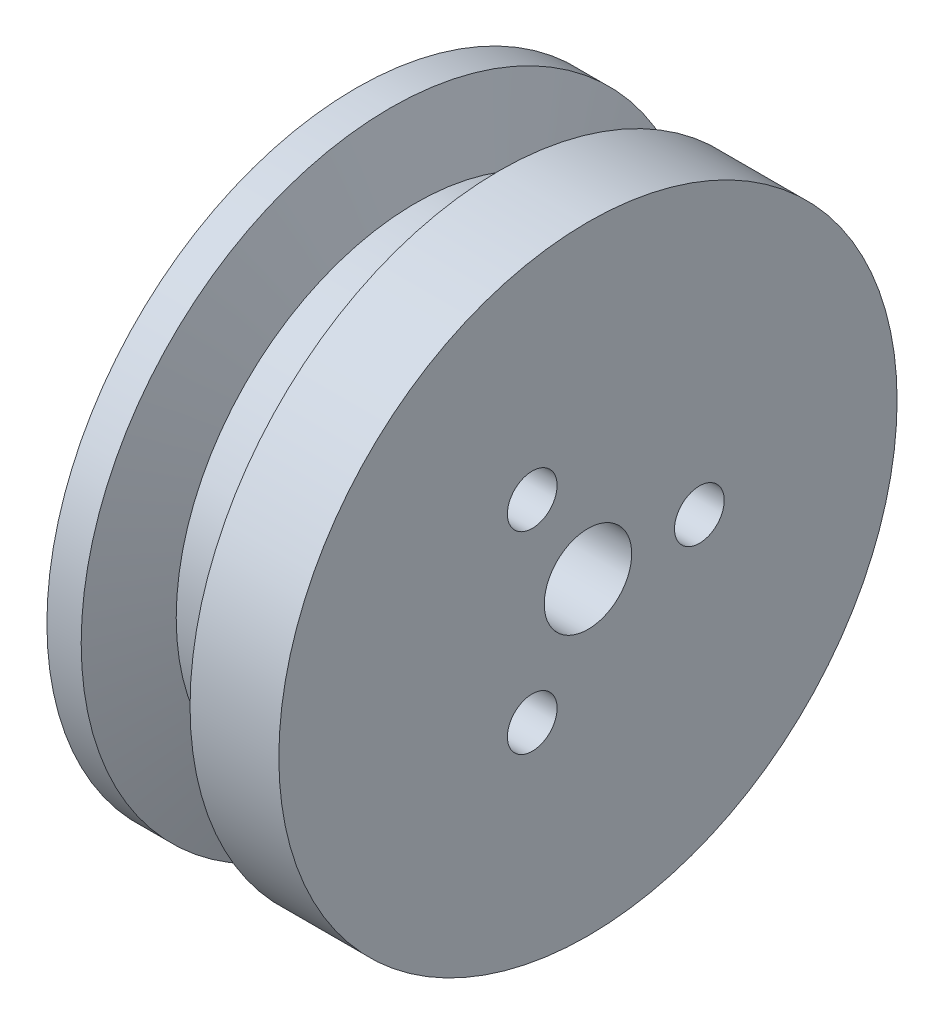
from build123d import *

# Parameters (mm, degrees)
CBORE_FOR_M2_5_SHCS1_D           = 2.9
CBORE_FOR_M2_5_SHCS1_CBORE_D     = 5.5
CBORE_FOR_M2_5_SHCS1_CBORE_DEPTH = 2.5
F_10_32_TAPPED_HOLE1_D           = 4.0386


with BuildPart() as part:
    # Sketch1 → Revolve1 (revolve)
    with BuildSketch(Plane.XY):
        Polygon((0, 0), (0, 18.034), (2, 18.034), (3.479175032, 13.97), (6.870824968, 13.97), (8.35, 18.034), (13.53, 18.034), (13.53, 2.55), (8.53, 2.55), (8.53, 0), align=None)
    revolve(axis=Axis((0, 0, 0), (1, 0, 0)))

    # CBORE for M2.5 SHCS1 (through all)
    with Locations(Plane.ZY):
        with Locations((-6.5, 0), (3.25, 5.629165125), (3.25, -5.629165125)):
            CounterBoreHole(CBORE_FOR_M2_5_SHCS1_D / 2, CBORE_FOR_M2_5_SHCS1_CBORE_D / 2, CBORE_FOR_M2_5_SHCS1_CBORE_DEPTH)

    # #10-32 Tapped Hole1 (through all)
    with Locations(Plane.ZY):
        with Locations((0, 0)):
            Hole(F_10_32_TAPPED_HOLE1_D / 2)


solid = part.part
